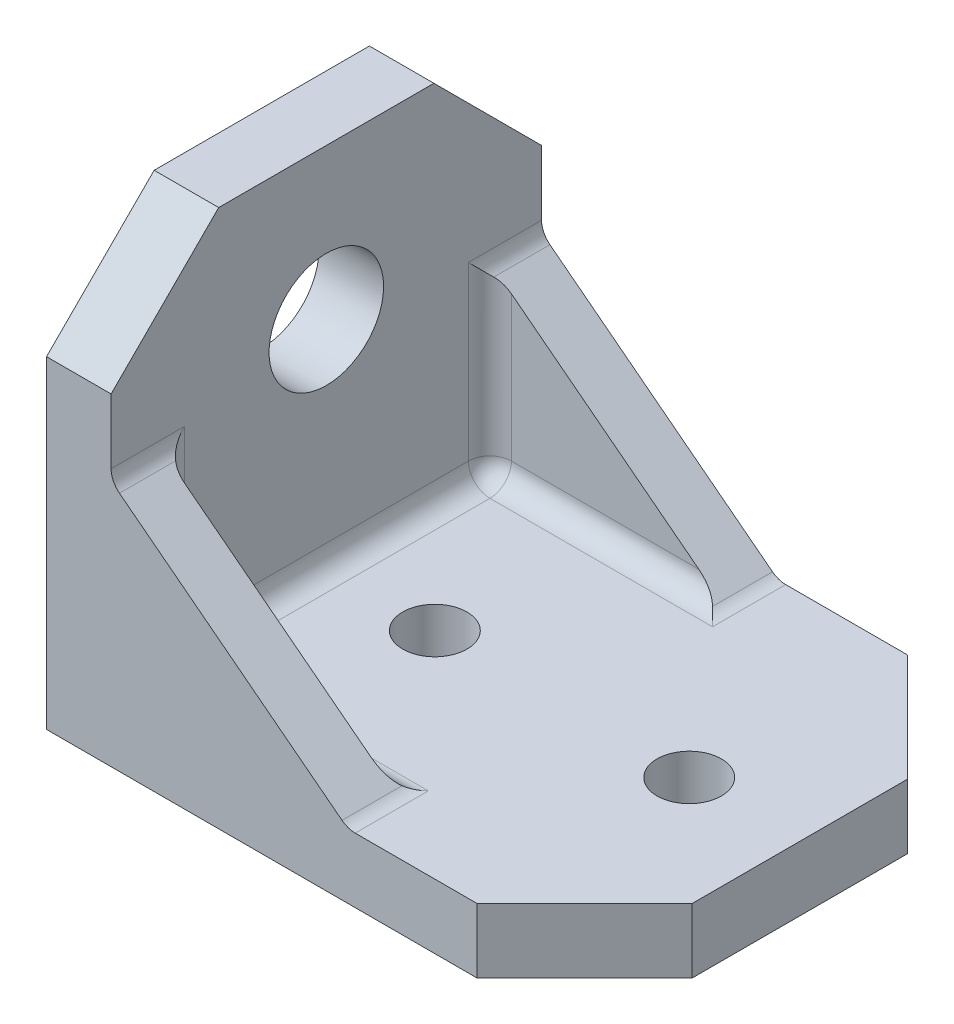
from build123d import *

# Parameters (mm, degrees)
BOSS_EXTRUDE1_DEPTH     = 25.4
F_6_CLEARANCE_HOLE1_D   = 3.7973
F_1_4_CLEARANCE_HOLE1_D = 6.7564
BOSS_EXTRUDE2_DEPTH     = 3.048
BOSS_EXTRUDE3_DEPTH     = 3.048
FILLET1_R               = 1.27
CHAMFER1_SIZE           = 6.35


with BuildPart() as part:
    # Sketch1 → Boss-Extrude1 (new body)
    with BuildSketch(Plane.XY):
        Polygon((0, 0), (0, 25.4), (3.81, 25.4), (3.81, 3.81), (31.75, 3.81), (31.75, 0), align=None)
    extrude(amount=BOSS_EXTRUDE1_DEPTH)

    # #6 Clearance Hole1 (through all)
    with Locations(Plane(origin=(0, 3.81, 0), x_dir=(1, 0, 0), z_dir=(0, 1, 0))):
        with Locations((10.2108, -12.7), (25.2222, -12.7)):
            Hole(F_6_CLEARANCE_HOLE1_D / 2)

    # 1/4 Clearance Hole1 (through all)
    with Locations(Plane(origin=(3.81, 0, 0), x_dir=(0, 0, -1), z_dir=(1, 0, 0))):
        with Locations((-12.7, 16.51)):
            Hole(F_1_4_CLEARANCE_HOLE1_D / 2)

    # Sketch6 → Boss-Extrude2 (add)
    with BuildSketch(Plane.XY.offset(25.4)):
        Polygon((3.81, 3.81), (17.78, 3.81), (3.81, 14.605), align=None)
    extrude(amount=-BOSS_EXTRUDE2_DEPTH)

    # Sketch7 → Boss-Extrude3 (add)
    with BuildSketch(Plane(origin=(0, 0, 0), x_dir=(-1, 0, 0), z_dir=(0, 0, -1))):
        Polygon((-3.81, 3.81), (-17.78, 3.81), (-3.81, 14.605), align=None)
    extrude(amount=-BOSS_EXTRUDE3_DEPTH)

    # Fillet1
    fillet1_edges = [part.edges().sort_by_distance(p)[0] for p in [
        (17.78, 3.81, 23.876),
        (3.81, 14.605, 23.876),
        (3.81, 14.605, 1.524),
        (17.78, 3.81, 1.524),
        (10.795, 3.81, 22.352),
        (3.81, 9.2075, 22.352),
        (10.795, 3.81, 3.048),
        (3.81, 9.2075, 3.048),
        (3.81, 3.81, 12.7),
    ]]
    fillet(fillet1_edges, radius=FILLET1_R)

    # Chamfer1
    chamfer1_edges = [part.edges().sort_by_distance(p)[0] for p in [
        (1.905, 25.4, 25.4),
        (1.905, 25.4, 0),
        (31.75, 1.905, 25.4),
        (31.75, 1.905, 0),
    ]]
    chamfer(chamfer1_edges, length=CHAMFER1_SIZE)


solid = part.part
